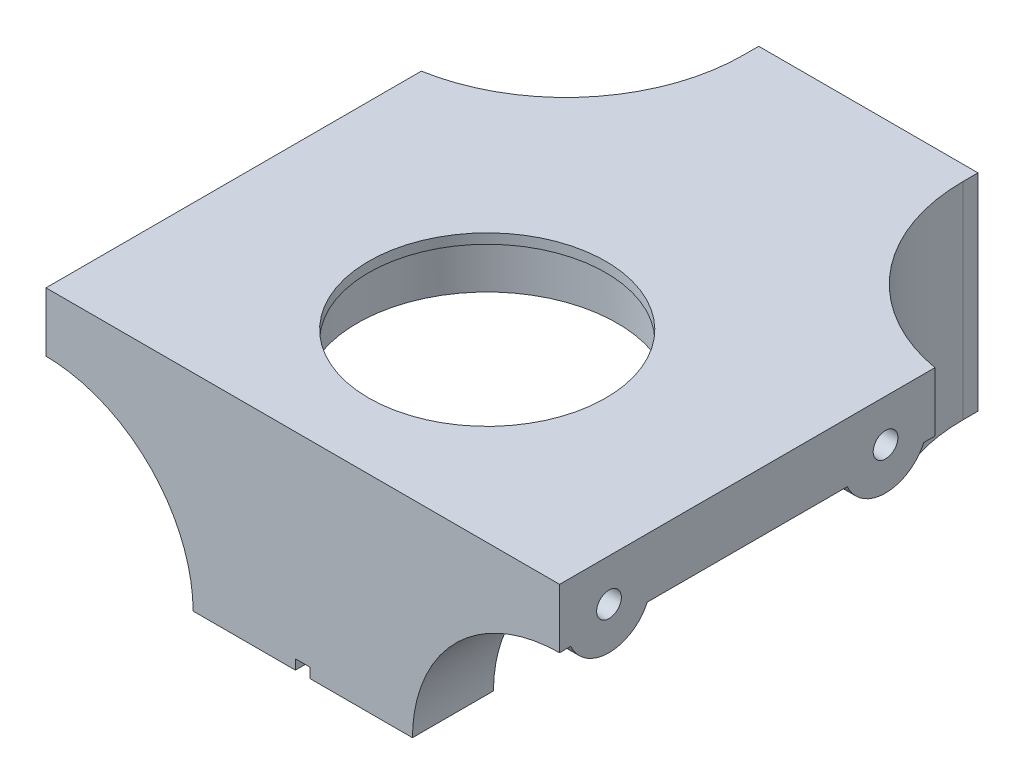
from build123d import *

# Parameters (mm, degrees)
SKETCH1_R                        = 12
EXTRUDE_799_DEPTH                = 6
SKETCH3_W                        = 22.200000000000003
SKETCH3_H                        = 8.199999999999994
EXTRUDE_1201_DEPTH               = 14.9
SKETCH4_R                        = 1
CUT_EXTRUDE_1534_DEPTH           = 5
CUT_EXTRUDE_1733_DEPTH           = 67.26852646618907
FILLET3_R                        = 18
FILLET4_R                        = 10.000000000000002
SKETCH7_R                        = 1.2499999999999991
CUT_EXTRUDE_2377_DEPTH           = 8
CUT_EXTRUDE_2377_DRAFT           = -1.0000000000000022
CUT_EXTRUDE_2377_PROFILE_2_DEPTH = 8
CUT_EXTRUDE_2377_PROFILE_2_DRAFT = -1.0000000000000022
SKETCH8_R                        = 1.2500000000000009
CUT_EXTRUDE_2_DEPTH              = 8
CUT_EXTRUDE_2_DRAFT              = -1.0000000000000022
CUT_EXTRUDE_2_PROFILE_2_DEPTH    = 8
CUT_EXTRUDE_2_PROFILE_2_DRAFT    = -1.0000000000000022
EXTRUDE_3098_DEPTH               = 12
EXTRUDE_START                    = -12
EXTRUDE_2_DEPTH                  = 12
EXTRUDE_3_DEPTH                  = 52
SKETCH5_R                        = 13.15
CUT_EXTRUDE_4061_DEPTH           = 19.9
FILLET5_SIZE                     = 6
FILLET5_SIZE_2                   = 2
VARFILLET3_R                     = 15


with BuildPart() as part:
    # Sketch1 → Extrude 799 (new body)
    with BuildSketch(Plane(origin=(0, 0, 0), x_dir=(1, 0, 0), z_dir=(0, 1, 0))):
        Polygon((-26, 19.329999999999995), (-11.1, 19.329999999999995), (-11.1, 38.59), (11.1, 38.59), (11.1, 19.329999999999995), (26.000000000000007, 19.329999999999995), (26.000000000000004, -18.670000000000005), (-26.000000000000004, -18.670000000000005), align=None)
        with Locations(Location((0, 0, 0), (0, 0, 270))):
            Circle(SKETCH1_R, mode=Mode.SUBTRACT)
    extrude(amount=-EXTRUDE_799_DEPTH)

    # Sketch3 → Extrude 1201 (add)
    with BuildSketch(Plane.XZ.offset(6)):
        Polygon((-11.1, -30.590000000000007), (11.1, -30.590000000000003), (11.1, -38.59), (-11.099999999999998, -38.59), align=None)
        with Locations((-3.55e-15, 14.570000000000004)):
            Rectangle(SKETCH3_W, SKETCH3_H)
    extrude(amount=EXTRUDE_1201_DEPTH)

    # Sketch4 → Cut-Extrude 1534 (cut)
    with BuildSketch(Plane.XZ.offset(20.900000000000002)):
        with Locations(Location((-5.000000000000001, -34.59000000000001, 0), (0, 0, 270))):
            Circle(SKETCH4_R)
        with Locations(Location((4.999999999999999, -34.59000000000001, 0), (0, 0, 270))):
            Circle(SKETCH4_R)
        with Locations(Location((4.999999999999999, 14.589999999999998, 0), (0, 0, 270))):
            Circle(SKETCH4_R)
        with Locations(Location((-5.000000000000045, 14.590000000000002, 0), (0, 0, 270))):
            Circle(SKETCH4_R)
    extrude(amount=-CUT_EXTRUDE_1534_DEPTH, mode=Mode.SUBTRACT)

    # Sketch6 → Cut-Extrude 1733 (cut, through all)
    with BuildSketch(Plane(origin=(0, 0, -38.59), x_dir=(-1, 0, 0), z_dir=(0, 0, -1))):
        Polygon((-0.7500000000000007, -19.900000000000002), (0.75, -19.900000000000002), (0.7500000000000007, -20.900000000000002), (-0.7500000000000007, -20.900000000000002), align=None)
    extrude(amount=-CUT_EXTRUDE_1733_DEPTH, mode=Mode.SUBTRACT)

    # Fillet3
    # the kernel refuses this fillet: 18 mm, written as the material it adds along each edge
    with BuildSketch(Plane(origin=(11.1, 0, -19.329999999999995), x_dir=(-1e-16, 0, -1), z_dir=(0, -1, 0))) as fillet3_piece_1_section:
        with BuildLine():
            CenterArc((17.73104621843064, 18.00000000000001), FILLET3_R, 189.91704895701648, 80.08295104298355)
            Line((3.37003e-12, 14.900000000000597), (-0.3546209243651767, 14.83800000000061))
            ThreePointArc((-0.3546209243651767, 14.83800000000061), (-0.36000000000000015, 7.4500000000002995), (-0.35999999999999943, -4e-17))
            Line((-0.35999999999999943, -4e-17), (4e-17, -0.35999999999999943))
            Line((4e-17, -0.35999999999999943), (17.731046218430645, -0.35999999999999943))
            Line((17.731046218430645, -0.35999999999999943), (17.731046218430645, 0))
        make_face()
    fillet3_piece_1 = extrude(amount=6, mode=Mode.PRIVATE)
    fillet3_piece_1 = split(fillet3_piece_1, bisect_by=Plane(origin=(11.202125787069557, -3.0000000000000004, -30.590000000000003), z_dir=(1.6e-16, 0, -1)), keep=Keep.TOP, mode=Mode.PRIVATE)
    add(fillet3_piece_1)
    with BuildSketch(Plane(origin=(11.1, 0, -19.329999999999995), x_dir=(-1e-16, 0, -1), z_dir=(0, -1, 0))) as fillet3_piece_2_section:
        with BuildLine():
            CenterArc((17.73104621843064, 18.00000000000001), FILLET3_R, 189.91704895701648, 80.08295104298355)
            Line((3.37003e-12, 14.900000000000597), (-0.3546209243651767, 14.83800000000061))
            ThreePointArc((-0.3546209243651767, 14.83800000000061), (-0.36000000000000015, 7.4500000000002995), (-0.35999999999999943, -4e-17))
            Line((-0.35999999999999943, -4e-17), (4e-17, -0.35999999999999943))
            Line((4e-17, -0.35999999999999943), (17.731046218430645, -0.35999999999999943))
            Line((17.731046218430645, -0.35999999999999943), (17.731046218430645, 0))
        make_face()
    fillet3_piece_2 = extrude(amount=6, mode=Mode.PRIVATE)
    fillet3_piece_2 = split(fillet3_piece_2, bisect_by=Plane(origin=(15.02685431404406, -3.0000000000000004, -30.590000000000003), z_dir=(-1.6e-16, 0, 1)), keep=Keep.TOP, mode=Mode.PRIVATE)
    add(fillet3_piece_2)
    with BuildSketch(Plane(origin=(11.1, 0, -19.329999999999995), x_dir=(-1e-16, 0, -1), z_dir=(0, -1, 0))) as fillet3_piece_3_section:
        with BuildLine():
            CenterArc((17.73104621843064, 18.00000000000001), FILLET3_R, 189.91704895701648, 80.08295104298355)
            Line((3.37003e-12, 14.900000000000597), (-0.3546209243651767, 14.83800000000061))
            ThreePointArc((-0.3546209243651767, 14.83800000000061), (-0.36000000000000015, 7.4500000000002995), (-0.35999999999999943, -4e-17))
            Line((-0.35999999999999943, -4e-17), (4e-17, -0.35999999999999943))
            Line((4e-17, -0.35999999999999943), (17.731046218430645, -0.35999999999999943))
            Line((17.731046218430645, -0.35999999999999943), (17.731046218430645, 0))
        make_face()
    fillet3_piece_3 = extrude(amount=50.327615546076615, mode=Mode.PRIVATE)
    fillet3_piece_3 = split(fillet3_piece_3, bisect_by=Plane(origin=(11.202125787069559, -6, -32.97275212026306), z_dir=(0, -1, 0)), keep=Keep.TOP, mode=Mode.PRIVATE)
    fillet3_piece_3 = split(fillet3_piece_3, bisect_by=Plane(origin=(11.202125787069557, -13.45, -30.590000000000003), z_dir=(1.6e-16, 0, -1)), keep=Keep.TOP, mode=Mode.PRIVATE)
    fillet3_piece_3 = split(fillet3_piece_3, bisect_by=Plane(origin=(11.202125787069559, -20.9, -32.97275212026306), z_dir=(0, 1, 0)), keep=Keep.TOP, mode=Mode.PRIVATE)
    add(fillet3_piece_3)
    with BuildSketch(Plane(origin=(-11.1, 0, -19.329999999999995), x_dir=(-1, 0, -1.9456e-13), z_dir=(0, -1, 0))) as fillet3_piece_4_section:
        with BuildLine():
            CenterArc((18.000000000003457, 17.731046218426652), FILLET3_R, 179.99999999998886, 80.08295104298327)
            Line((3.44806e-12, 17.731046218430155), (-0.35999999999655136, 17.731046218430226))
            Line((-0.35999999999655136, 17.731046218430226), (-0.35999999999999943, 7.004e-14))
            Line((-0.35999999999999943, 7.004e-14), (-7.004e-14, -0.35999999999999943))
            ThreePointArc((-7.004e-14, -0.35999999999999943), (7.450000000000183, -0.36000000000144894), (14.838000000000449, -0.3546209243685347))
            Line((14.838000000000449, -0.3546209243685347), (14.900000000000508, 0))
        make_face()
    fillet3_piece_4 = extrude(amount=6, mode=Mode.PRIVATE)
    fillet3_piece_4 = split(fillet3_piece_4, bisect_by=Plane(origin=(-15.026854314042824, -3.0000000000000004, -30.590000000000007), z_dir=(-1.6e-16, 0, 1)), keep=Keep.TOP, mode=Mode.PRIVATE)
    add(fillet3_piece_4)
    with BuildSketch(Plane(origin=(-11.1, 0, -19.329999999999995), x_dir=(-1, 0, -1.9456e-13), z_dir=(0, -1, 0))) as fillet3_piece_5_section:
        with BuildLine():
            CenterArc((18.000000000003457, 17.731046218426652), FILLET3_R, 179.99999999998886, 80.08295104298327)
            Line((3.44806e-12, 17.731046218430155), (-0.35999999999655136, 17.731046218430226))
            Line((-0.35999999999655136, 17.731046218430226), (-0.35999999999999943, 7.004e-14))
            Line((-0.35999999999999943, 7.004e-14), (-7.004e-14, -0.35999999999999943))
            ThreePointArc((-7.004e-14, -0.35999999999999943), (7.450000000000183, -0.36000000000144894), (14.838000000000449, -0.3546209243685347))
            Line((14.838000000000449, -0.3546209243685347), (14.900000000000508, 0))
        make_face()
    fillet3_piece_5 = extrude(amount=6, mode=Mode.PRIVATE)
    fillet3_piece_5 = split(fillet3_piece_5, bisect_by=Plane(origin=(-11.20212578706951, -3.0000000000000004, -30.590000000000007), z_dir=(1.6e-16, 0, -1)), keep=Keep.TOP, mode=Mode.PRIVATE)
    add(fillet3_piece_5)
    with BuildSketch(Plane(origin=(-11.1, 0, -19.329999999999995), x_dir=(-1, 0, -1.9456e-13), z_dir=(0, -1, 0))) as fillet3_piece_6_section:
        with BuildLine():
            CenterArc((18.000000000003457, 17.731046218426652), FILLET3_R, 179.99999999998886, 80.08295104298327)
            Line((3.44806e-12, 17.731046218430155), (-0.35999999999655136, 17.731046218430226))
            Line((-0.35999999999655136, 17.731046218430226), (-0.35999999999999943, 7.004e-14))
            Line((-0.35999999999999943, 7.004e-14), (-7.004e-14, -0.35999999999999943))
            ThreePointArc((-7.004e-14, -0.35999999999999943), (7.450000000000183, -0.36000000000144894), (14.838000000000449, -0.3546209243685347))
            Line((14.838000000000449, -0.3546209243685347), (14.900000000000508, 0))
        make_face()
    fillet3_piece_6 = extrude(amount=50.32761554607538, mode=Mode.PRIVATE)
    fillet3_piece_6 = split(fillet3_piece_6, bisect_by=Plane(origin=(-11.202125787069509, -6, -32.97275212026291), z_dir=(0, -1, 0)), keep=Keep.TOP, mode=Mode.PRIVATE)
    fillet3_piece_6 = split(fillet3_piece_6, bisect_by=Plane(origin=(-11.202125787069509, -13.449999999999994, -30.590000000000007), z_dir=(1.6e-16, 0, -1)), keep=Keep.TOP, mode=Mode.PRIVATE)
    fillet3_piece_6 = split(fillet3_piece_6, bisect_by=Plane(origin=(-11.202125787069509, -20.9, -32.97275212026291), z_dir=(0, 1, 0)), keep=Keep.TOP, mode=Mode.PRIVATE)
    add(fillet3_piece_6)

    # Fillet4
    fillet4_edges = [part.edges().sort_by_distance(p)[0] for p in [
        (-7.2653e-13, -6, -30.589999999999996),
    ]]
    fillet(fillet4_edges, radius=FILLET4_R)


with BuildPart() as cut_extrude_2377_tool:
    # Sketch7 → Cut-Extrude 2377 (with draft: the straight prism first)
    with BuildSketch(Plane(origin=(26.000000000000004, 0, 2.37e-15), x_dir=(9e-17, 0, -1), z_dir=(1, 0, 9e-17))):
        with Locations((-13.670000000000002, -4.25)):
            Circle(SKETCH7_R)
    extrude(amount=-CUT_EXTRUDE_2377_DEPTH)
    # Cut-Extrude 2377: the draft: its side faces are tilted about the plane it starts from
    cut_extrude_2377_sides = [cut_extrude_2377_tool.faces().sort_by_distance(p)[0] for p in [
        (22, -4.25, 14.92),
    ]]
    draft(cut_extrude_2377_sides, Plane(origin=(26.000000000000004, 0, 2.37e-15), x_dir=(9e-17, 0, -1), z_dir=(1, 0, 9e-17)), CUT_EXTRUDE_2377_DRAFT)


with BuildPart() as part_1:
    add(part.part)

    # Cut-Extrude 2377: cut by cut_extrude_2377_tool
    add(cut_extrude_2377_tool.part, mode=Mode.SUBTRACT)


with BuildPart() as cut_extrude_2377_profile_2_tool:
    # Sketch7 → Cut-Extrude 2377 profile 2 (with draft: the straight prism first)
    with BuildSketch(Plane(origin=(26.000000000000004, 0, 2.37e-15), x_dir=(9e-17, 0, -1), z_dir=(1, 0, 9e-17))):
        with Locations((14.329999999999998, -4.25)):
            Circle(SKETCH7_R)
    extrude(amount=-CUT_EXTRUDE_2377_PROFILE_2_DEPTH)
    # Cut-Extrude 2377 profile 2: the draft: its side faces are tilted about the plane it starts from
    cut_extrude_2377_profile_2_sides = [cut_extrude_2377_profile_2_tool.faces().sort_by_distance(p)[0] for p in [
        (22, -4.25, -13.08),
    ]]
    draft(cut_extrude_2377_profile_2_sides, Plane(origin=(26.000000000000004, 0, 2.37e-15), x_dir=(9e-17, 0, -1), z_dir=(1, 0, 9e-17)), CUT_EXTRUDE_2377_PROFILE_2_DRAFT)


with BuildPart() as part_2:
    add(part_1.part)

    # Cut-Extrude 2377 profile 2: cut by cut_extrude_2377_profile_2_tool
    add(cut_extrude_2377_profile_2_tool.part, mode=Mode.SUBTRACT)


with BuildPart() as cut_extrude_2_tool:
    # Sketch8 → отверстие под саморезы 2 (with draft: the straight prism first)
    with BuildSketch(Plane.ZY.offset(26.000000000000004)):
        with Locations((-14.32999999999999, -4.25)):
            Circle(SKETCH8_R)
    extrude(amount=-CUT_EXTRUDE_2_DEPTH)
    # отверстие под саморезы 2: the draft: its side faces are tilted about the plane it starts from
    cut_extrude_2_sides = [cut_extrude_2_tool.faces().sort_by_distance(p)[0] for p in [
        (-22, -4.25, -15.58),
    ]]
    draft(cut_extrude_2_sides, Plane.ZY.offset(26.000000000000004), CUT_EXTRUDE_2_DRAFT)


with BuildPart() as part_3:
    add(part_2.part)

    # отверстие под саморезы 2: cut by cut_extrude_2_tool
    add(cut_extrude_2_tool.part, mode=Mode.SUBTRACT)


with BuildPart() as cut_extrude_2_profile_2_tool:
    # Sketch8 → отверстие под саморезы 2 profile 2 (with draft: the straight prism first)
    with BuildSketch(Plane.ZY.offset(26.000000000000004)):
        with Locations((13.670000000000009, -4.25)):
            Circle(SKETCH8_R)
    extrude(amount=-CUT_EXTRUDE_2_PROFILE_2_DEPTH)
    # отверстие под саморезы 2 profile 2: the draft: its side faces are tilted about the plane it starts from
    cut_extrude_2_profile_2_sides = [cut_extrude_2_profile_2_tool.faces().sort_by_distance(p)[0] for p in [
        (-22, -4.25, 12.42),
    ]]
    draft(cut_extrude_2_profile_2_sides, Plane.ZY.offset(26.000000000000004), CUT_EXTRUDE_2_PROFILE_2_DRAFT)


with BuildPart() as part_4:
    add(part_3.part)

    # отверстие под саморезы 2 profile 2: cut by cut_extrude_2_profile_2_tool
    add(cut_extrude_2_profile_2_tool.part, mode=Mode.SUBTRACT)

    # Sketch9 → Extrude 3098 (add)
    with BuildSketch(Plane.ZY.offset(26.000000000000004)):
        with BuildLine():
            Line((-10.079999999999988, -4.250000000000001), (-13.079999999999988, -4.2500000000000036))
            ThreePointArc((-13.079999999999988, -4.2500000000000036), (-14.32999999999999, -5.5), (-15.57999999999999, -4.250000000000004))
            Line((-15.57999999999999, -4.250000000000004), (-18.579999999999988, -4.250000000000002))
            ThreePointArc((-18.579999999999988, -4.250000000000002), (-14.329999999999988, -8.499999999999998), (-10.079999999999988, -4.250000000000001))
        make_face()
    extrude(amount=-EXTRUDE_3098_DEPTH)

    # Sketch10 → утолщение2 (add)
    with BuildSketch(Plane(origin=(26.000000000000004, 0, 2.37e-15), x_dir=(9e-17, 0, -1), z_dir=(1, 0, 9e-17)).offset(EXTRUDE_START)):
        with BuildLine():
            Line((15.579999999999998, -4.25), (18.58, -4.25))
            ThreePointArc((18.58, -4.25), (14.33, -8.500000000000009), (10.079999999999991, -4.25))
            Line((10.079999999999991, -4.25), (13.08, -4.25))
            ThreePointArc((13.08, -4.25), (14.33, -5.5), (15.579999999999998, -4.25))
        make_face()
    extrude(amount=EXTRUDE_2_DEPTH)

    # Sketch12 → утолщение3 (add, through all)
    with BuildSketch(Plane.ZY.offset(26.000000000000004)):
        with BuildLine():
            Line((12.420000000000007, -4.25), (9.420000000000009, -4.25))
            ThreePointArc((9.420000000000009, -4.25), (13.670000000000009, -8.5), (17.92000000000001, -4.25))
            Line((17.92000000000001, -4.25), (14.920000000000009, -4.25))
            ThreePointArc((14.920000000000009, -4.25), (13.670000000000009, -5.500000000000002), (12.420000000000007, -4.25))
        make_face()
    extrude(amount=-EXTRUDE_3_DEPTH)

    # Sketch5 → Cut-Extrude 4061 (cut)
    with BuildSketch(Plane.XZ.offset(20.900000000000002)):
        with Locations(Location((0, 0, 0), (0, 0, 131.839159328))):
            Circle(SKETCH5_R)
    extrude(amount=-CUT_EXTRUDE_4061_DEPTH, mode=Mode.SUBTRACT)

    # Fillet5
    # an asymmetric fillet: 6, 2 mm, written as the material it takes off along each edge
    with BuildSketch(Plane(origin=(-14.000000000000002, -4.249999999999998, -14.32999999999999), x_dir=(0, 0.9999950652018581, -0.0031415874858792595), z_dir=(0, 0.0031415874858792595, 0.9999950652018581))) as fillet5_piece_1_section:
        with BuildLine():
            Bezier((4.249999999999999, FILLET5_SIZE), (4.249999999999999, 0), (4.249999999999999 - FILLET5_SIZE_2, 0), weights=[1, 0.7071067811865476, 1])
            Line((4.249999999999999 - FILLET5_SIZE_2, 0), (4.249999999999999, 0))
            Line((4.249999999999999, 0), (4.249999999999999, FILLET5_SIZE))
        make_face()
    fillet5_piece_1 = revolve(axis=Axis((-14.000000000000002, -4.249999999999998, -14.32999999999999), (-1, 0, -9e-17)), revolution_arc=359.64000000000004, mode=Mode.PRIVATE)
    fillet5_piece_1 = split(fillet5_piece_1, bisect_by=Plane(origin=(-15.747507376249184, -6, -14.32999999999999), z_dir=(0, -1, 0)), keep=Keep.TOP, mode=Mode.PRIVATE)
    add(fillet5_piece_1, mode=Mode.SUBTRACT)
    with BuildSketch(Plane(origin=(14.000000000000005, -4.250000000000005, -14.329999999999993), x_dir=(0, 0.9999950652018581, -0.003141587485879675), z_dir=(0, 0.003141587485879675, 0.9999950652018581))) as fillet5_piece_2_section:
        with BuildLine():
            Bezier((4.250000000000003, -FILLET5_SIZE), (4.250000000000003, 1.78e-15), (4.250000000000003 - FILLET5_SIZE_2, 0), weights=[1, 0.7071067811865476, 1])
            Line((4.250000000000003 - FILLET5_SIZE_2, 0), (4.250000000000003, 0))
            Line((4.250000000000003, 0), (4.250000000000003, -FILLET5_SIZE))
        make_face()
    fillet5_piece_2 = revolve(axis=Axis((14.000000000000005, -4.250000000000005, -14.329999999999993), (-1, 0, -9e-17)), revolution_arc=359.63999999999993, mode=Mode.PRIVATE)
    fillet5_piece_2 = split(fillet5_piece_2, bisect_by=Plane(origin=(15.747507376249192, -6, -14.329999999999993), z_dir=(0, -1, 0)), keep=Keep.TOP, mode=Mode.PRIVATE)
    add(fillet5_piece_2, mode=Mode.SUBTRACT)

    # VarFillet3
    # the kernel refuses this fillet: 15 mm, written as the material it adds along each edge
    with BuildSketch(Plane(origin=(-11.100000000000005, -6, -19.95701665379257), x_dir=(-1, 0, 0), z_dir=(0, 0, 1))) as varfillet3_piece_1_section:
        with BuildLine():
            CenterArc((VARFILLET3_R, VARFILLET3_R), VARFILLET3_R, 180, 90)
            Line((0, VARFILLET3_R), (0, 0))
            Line((0, 0), (VARFILLET3_R, 0))
        make_face()
    varfillet3_piece_1 = extrude(amount=38.62701665379257, mode=Mode.PRIVATE)
    varfillet3_piece_1 = split(varfillet3_piece_1, bisect_by=Plane(origin=(-26.000000000000004, -10.904993507438517, 14.985695113471913), z_dir=(1, 0, 9e-17)), keep=Keep.TOP, mode=Mode.PRIVATE)
    varfillet3_piece_1 = varfillet3_piece_1 - Plane(origin=(-13.350397551910326, -4.25, 13.670000000000009), x_dir=(9e-17, 0, -1), z_dir=(-1, 0, -9e-17)) * Cylinder(4.25, 138, mode=Mode.PRIVATE)
    varfillet3_piece_1 = split(varfillet3_piece_1, bisect_by=Plane(origin=(-13.350397551910326, -20.9, 14.985695113471914), z_dir=(0, 1, 0)), keep=Keep.TOP, mode=Mode.PRIVATE)
    varfillet3_piece_1 = split(varfillet3_piece_1, bisect_by=Plane(origin=(-13.350397551910326, -10.904993507438517, 10.470000000000008), z_dir=(0, 0, 1)), keep=Keep.TOP, mode=Mode.PRIVATE)
    add(varfillet3_piece_1)
    with BuildSketch(Plane(origin=(-11.100000000000005, -6, -19.95701665379257), x_dir=(-1, 0, 0), z_dir=(0, 0, 1))) as varfillet3_piece_2_section:
        with BuildLine():
            CenterArc((VARFILLET3_R, VARFILLET3_R), VARFILLET3_R, 180, 90)
            Line((0, VARFILLET3_R), (0, 0))
            Line((0, 0), (VARFILLET3_R, 0))
        make_face()
    varfillet3_piece_2 = extrude(amount=38.62701665379257, mode=Mode.PRIVATE)
    varfillet3_piece_2 = split(varfillet3_piece_2, bisect_by=Plane(origin=(-26.000000000000004, -6.137593648548207, 10.174457280584232), z_dir=(1, 0, 9e-17)), keep=Keep.TOP, mode=Mode.PRIVATE)
    varfillet3_piece_2 = varfillet3_piece_2 & Plane(origin=(-17.56877873055842, -4.25, 13.670000000000007), x_dir=(9e-17, 0, -1), z_dir=(-1, 0, -9e-17)) * Cylinder(4.25, 138, mode=Mode.PRIVATE)
    varfillet3_piece_2 = split(varfillet3_piece_2, bisect_by=Plane(origin=(-17.56877873055842, -6.137593648548207, 10.470000000000008), z_dir=(0, 0, -1)), keep=Keep.TOP, mode=Mode.PRIVATE)
    add(varfillet3_piece_2)
    with BuildSketch(Plane(origin=(-11.100000000000005, -6, -19.95701665379257), x_dir=(-1, 0, 0), z_dir=(0, 0, 1))) as varfillet3_piece_3_section:
        with BuildLine():
            CenterArc((VARFILLET3_R, VARFILLET3_R), VARFILLET3_R, 180, 90)
            Line((0, VARFILLET3_R), (0, 0))
            Line((0, 0), (VARFILLET3_R, 0))
        make_face()
    varfillet3_piece_3 = extrude(amount=38.62701665379257, mode=Mode.PRIVATE)
    varfillet3_piece_3 = split(varfillet3_piece_3, bisect_by=Plane(origin=(-26.000000000000004, -6.724165280415923, 13.83721489722381), z_dir=(1, 0, 9e-17)), keep=Keep.TOP, mode=Mode.PRIVATE)
    varfillet3_piece_3 = varfillet3_piece_3 & Plane(origin=(-16.503664991395443, -4.25, 13.670000000000007), x_dir=(9e-17, 0, -1), z_dir=(-1, 0, -9e-17)) * Cylinder(4.25, 138, mode=Mode.PRIVATE)
    varfillet3_piece_3 = split(varfillet3_piece_3, bisect_by=Plane(origin=(-16.503664991395443, -6.724165280415923, 10.470000000000008), z_dir=(0, 0, 1)), keep=Keep.TOP, mode=Mode.PRIVATE)
    add(varfillet3_piece_3)
    with BuildSketch(Plane(origin=(11.099999999999998, -6, 18.67), x_dir=(0, -1, 0), z_dir=(0, 0, -1))) as varfillet3_piece_4_section:
        with BuildLine():
            CenterArc((VARFILLET3_R, -VARFILLET3_R), VARFILLET3_R, 90, 90)
            Line((-3.55e-15, -VARFILLET3_R), (0, 0))
            Line((0, 0), (VARFILLET3_R, 0))
        make_face()
    varfillet3_piece_4 = extrude(amount=38.62701665379255, mode=Mode.PRIVATE)
    varfillet3_piece_4 = split(varfillet3_piece_4, bisect_by=Plane(origin=(26.000000000000004, -10.904994661571926, 14.985692919393248), z_dir=(-1, 0, -9e-17)), keep=Keep.TOP, mode=Mode.PRIVATE)
    varfillet3_piece_4 = varfillet3_piece_4 - Plane(origin=(13.350401544898947, -4.25, 13.67000000000001), x_dir=(9e-17, 0, -1), z_dir=(-1, 0, -9e-17)) * Cylinder(4.25, 138, mode=Mode.PRIVATE)
    varfillet3_piece_4 = split(varfillet3_piece_4, bisect_by=Plane(origin=(13.350401544898945, -10.904994661571926, 10.470000000000008), z_dir=(0, 0, 1)), keep=Keep.TOP, mode=Mode.PRIVATE)
    varfillet3_piece_4 = split(varfillet3_piece_4, bisect_by=Plane(origin=(13.350401544898945, -20.9, 14.985692919393243), z_dir=(0, 1, 0)), keep=Keep.TOP, mode=Mode.PRIVATE)
    add(varfillet3_piece_4)
    with BuildSketch(Plane(origin=(11.099999999999998, -6, 18.67), x_dir=(0, -1, 0), z_dir=(0, 0, -1))) as varfillet3_piece_5_section:
        with BuildLine():
            CenterArc((VARFILLET3_R, -VARFILLET3_R), VARFILLET3_R, 90, 90)
            Line((-3.55e-15, -VARFILLET3_R), (0, 0))
            Line((0, 0), (VARFILLET3_R, 0))
        make_face()
    varfillet3_piece_5 = extrude(amount=38.62701665379255, mode=Mode.PRIVATE)
    varfillet3_piece_5 = split(varfillet3_piece_5, bisect_by=Plane(origin=(26.000000000000004, -6.724165306685444, 13.83721454779344), z_dir=(-1, 0, -9e-17)), keep=Keep.TOP, mode=Mode.PRIVATE)
    varfillet3_piece_5 = varfillet3_piece_5 & Plane(origin=(16.503666094345423, -4.25, 13.67000000000001), x_dir=(9e-17, 0, -1), z_dir=(-1, 0, -9e-17)) * Cylinder(4.25, 138, mode=Mode.PRIVATE)
    varfillet3_piece_5 = split(varfillet3_piece_5, bisect_by=Plane(origin=(16.503666094345423, -6.724165306685444, 10.470000000000008), z_dir=(0, 0, 1)), keep=Keep.TOP, mode=Mode.PRIVATE)
    add(varfillet3_piece_5)
    with BuildSketch(Plane(origin=(11.099999999999998, -6, 18.67), x_dir=(0, -1, 0), z_dir=(0, 0, -1))) as varfillet3_piece_6_section:
        with BuildLine():
            CenterArc((VARFILLET3_R, -VARFILLET3_R), VARFILLET3_R, 90, 90)
            Line((-3.55e-15, -VARFILLET3_R), (0, 0))
            Line((0, 0), (VARFILLET3_R, 0))
        make_face()
    varfillet3_piece_6 = extrude(amount=38.62701665379255, mode=Mode.PRIVATE)
    varfillet3_piece_6 = split(varfillet3_piece_6, bisect_by=Plane(origin=(26.000000000000004, -6.137593646683274, 10.174457281109184), z_dir=(-1, 0, -9e-17)), keep=Keep.TOP, mode=Mode.PRIVATE)
    varfillet3_piece_6 = varfillet3_piece_6 & Plane(origin=(17.56877869488144, -4.25, 13.67000000000001), x_dir=(9e-17, 0, -1), z_dir=(-1, 0, -9e-17)) * Cylinder(4.25, 138, mode=Mode.PRIVATE)
    varfillet3_piece_6 = split(varfillet3_piece_6, bisect_by=Plane(origin=(17.568778694881438, -6.137593646683274, 10.470000000000008), z_dir=(0, 0, -1)), keep=Keep.TOP, mode=Mode.PRIVATE)
    add(varfillet3_piece_6)


solid = part_4.part
